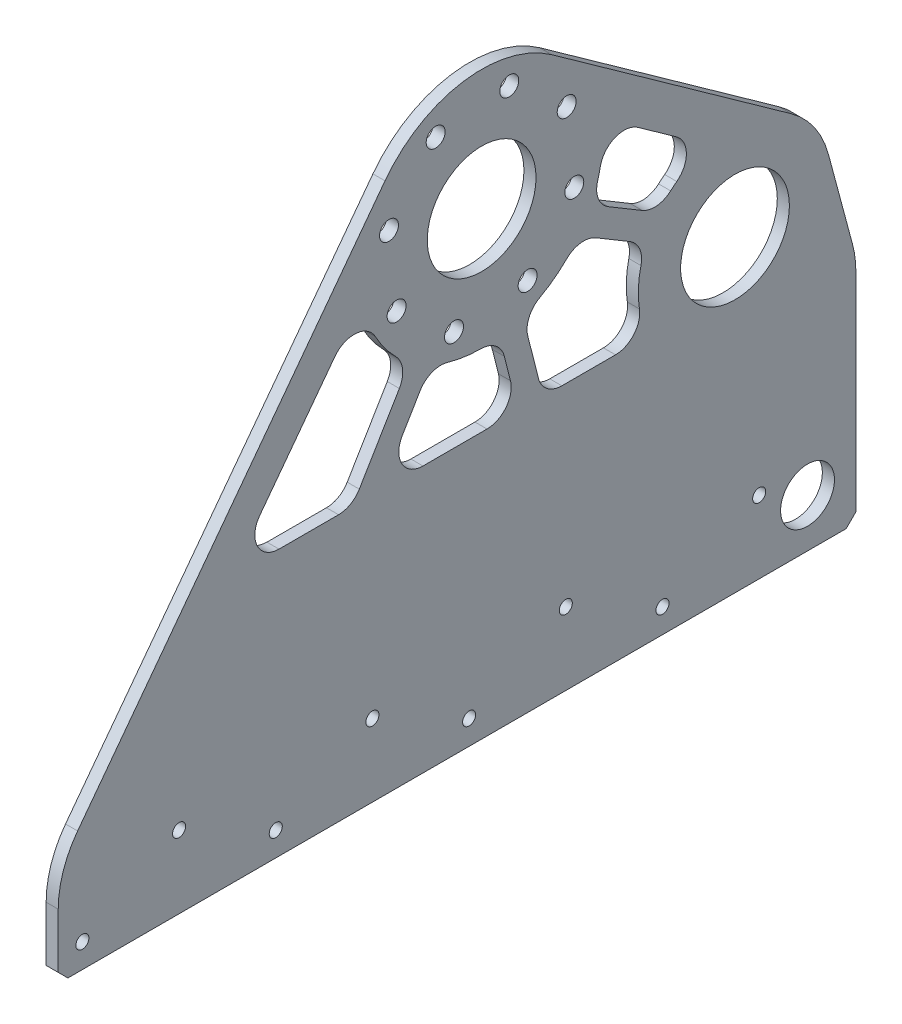
from build123d import *

# Parameters (mm, degrees)
SKETCH1_R                    = 14.2875
BOSS_EXTRUDE1_DEPTH          = 3.175
F_10_CLEARANCE_HOLE1_D       = 4.9784
SKETCH9_R                    = 7.0739
CUT_EXTRUDE1_DEPTH           = 246.051592782
FILLET1_R                    = 6.35
F_1_8_0_135_DIAMETER_HOLE1_D = 3.429
CHAMFER1_SIZE                = 2.54


with BuildPart() as part:
    # Sketch1 → Boss-Extrude1 (new body)
    with BuildSketch(Plane(origin=(0, 0, 0), x_dir=(0, 0, -1), z_dir=(1, 0, 0))):
        with BuildLine():
            Line((0, -25.4), (0, 31.863977372))
            ThreePointArc((0, 31.863977372), (-0.217300521, 35.179342654), (-0.865484012, 38.437981118))
            Line((-0.865484012, 38.437981118), (-7.215484012, 62.136503746))
            ThreePointArc((-7.215484012, 62.136503746), (-10.879443925, 70.039374287), (-16.998077198, 76.239559115))
            Line((-16.998077198, 76.239559115), (-79.87164219, 121.096323894))
            ThreePointArc((-79.87164219, 121.096323894), (-103.165558841, 126.626759813), (-123.699445398, 114.31612306))
            Line((-123.699445398, 114.31612306), (-204.460319765, 6.777271443))
            ThreePointArc((-204.460319765, 6.777271443), (-208.244004669, -0.435792492), (-209.55, -8.475627004))
            Line((-209.55, -8.475627004), (-209.55, -25.4))
            Line((-209.55, -25.4), (0, -25.4))
        make_face()
        with Locations((-31.75, 55.5625)):
            Circle(SKETCH1_R, mode=Mode.SUBTRACT)
        with Locations((-98.311545692, 95.25)):
            Circle(SKETCH1_R, mode=Mode.SUBTRACT)
    extrude(amount=BOSS_EXTRUDE1_DEPTH)

    # #10 Clearance Hole1 (through all)
    with Locations(Plane(origin=(3.175, 0, 0), x_dir=(0, 0, -1), z_dir=(1, 0, 0))):
        with Locations((-91.050282965, 119.589968439), (-75.966100841, 107.326468623), (-73.971577253, 87.988737273), (-86.235077069, 72.904555149), (-105.572808419, 70.910031561), (-120.656990543, 83.173531377), (-122.651514131, 102.511262727), (-110.388014315, 117.595444851)):
            Hole(F_10_CLEARANCE_HOLE1_D / 2)

    # Sketch9 → Cut-Extrude1 (cut, through all)
    with BuildSketch(Plane(origin=(3.175, 0, 0), x_dir=(0, 0, -1), z_dir=(1, 0, 0))):
        with Locations((-12.7, -12.7)):
            Circle(SKETCH9_R)
        with BuildLine():
            Line((-164.256457276, 44.45), (-129.69901081, 90.465699272))
            ThreePointArc((-129.69901081, 90.465699272), (-125.509192978, 78.868593403), (-117.217117013, 69.742317372))
            Line((-117.217117013, 69.742317372), (-132.297729028, 44.45))
            Line((-132.297729028, 44.45), (-164.256457276, 44.45))
        make_face()
        with BuildLine():
            Line((-66.945646017, 100.173701616), (-38.671072347, 80.001377993))
            ThreePointArc((-38.671072347, 80.001377993), (-45.921454308, 76.641633825), (-51.769190034, 71.195542903))
            Line((-51.769190034, 71.195542903), (-69.551855526, 81.798504859))
            ThreePointArc((-69.551855526, 81.798504859), (-66.876157951, 90.791424263), (-66.945646017, 100.173701616))
        make_face()
        with BuildLine():
            Line((-55.021197572, 65.741466723), (-72.803863064, 76.344428679))
            ThreePointArc((-72.803863064, 76.344428679), (-79.339445973, 69.791761015), (-87.487017182, 65.402184627))
            Line((-87.487017182, 65.402184627), (-82.187487541, 44.45))
            Line((-82.187487541, 44.45), (-54.59014763, 44.45))
            ThreePointArc((-54.59014763, 44.45), (-57.144796276, 55.048377342), (-55.021197572, 65.741466723))
        make_face()
        with BuildLine():
            Line((-124.904634638, 44.45), (-111.763040833, 66.490309834))
            ThreePointArc((-111.763040833, 66.490309834), (-102.897938751, 63.833006211), (-93.643148017, 63.845086959))
            Line((-93.643148017, 63.845086959), (-88.737462043, 44.45))
            Line((-88.737462043, 44.45), (-124.904634638, 44.45))
        make_face()
    extrude(amount=-CUT_EXTRUDE1_DEPTH, mode=Mode.SUBTRACT)

    # Fillet1
    fillet1_edges = [part.edges().sort_by_distance(p)[0] for p in [
        (1.5875, 100.173701616, 66.945646017),
        (1.5875, 71.195542903, 51.769190034),
        (1.5875, 81.798504859, 69.551855526),
        (1.5875, 80.001377993, 38.671072347),
        (1.5875, 76.344428679, 72.803863064),
        (1.5875, 65.741466723, 55.021197572),
        (1.5875, 44.45, 82.187487541),
        (1.5875, 65.402184627, 87.487017182),
        (1.5875, 44.45, 54.59014763),
        (1.5875, 44.45, 124.904634638),
        (1.5875, 66.490309834, 111.763040833),
        (1.5875, 63.845086959, 93.643148017),
        (1.5875, 44.45, 88.737462043),
        (1.5875, 44.45, 164.256457276),
        (1.5875, 90.465699272, 129.69901081),
        (1.5875, 69.742317372, 117.217117013),
        (1.5875, 44.45, 132.297729028),
    ]]
    fillet(fillet1_edges, radius=FILLET1_R)

    # 1/8 (0.135) Diameter Hole1 (through all)
    with Locations(Plane(origin=(3.175, 0, 0), x_dir=(0, 0, -1), z_dir=(1, 0, 0))):
        with Locations((-177.8, -6.35), (-152.4, -19.05), (-127, -6.35), (-101.6, -19.05), (-76.2, -6.35), (-50.8, -19.05), (-25.4, -6.35), (-203.2, -19.05)):
            Hole(F_1_8_0_135_DIAMETER_HOLE1_D / 2)

    # Chamfer1
    chamfer1_edges = [part.edges().sort_by_distance(p)[0] for p in [
        (1.5875, -25.4, 0),
        (1.5875, -25.4, 209.55),
    ]]
    chamfer(chamfer1_edges, length=CHAMFER1_SIZE)


solid = part.part
